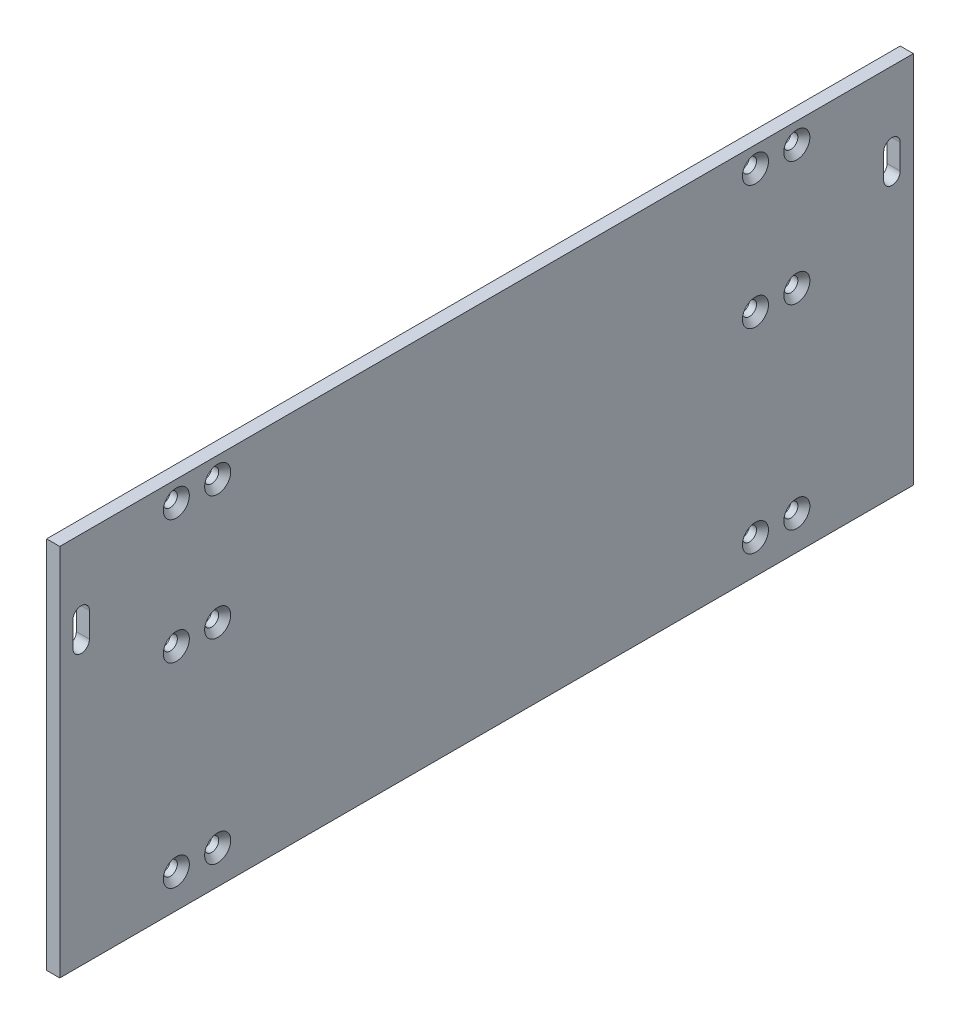
from build123d import *

# Parameters (mm, degrees)
BOSS_EXTRUDE1_DEPTH                             = 3.175
CSK_FOR_M3_FLAT_HEAD_MACHINE_SCREW1_D           = 3.4
CSK_FOR_M3_FLAT_HEAD_MACHINE_SCREW1_CSINK_D     = 6.3
CSK_FOR_M3_FLAT_HEAD_MACHINE_SCREW1_CSINK_ANGLE = 90
CUT_EXTRUDE1_DEPTH                              = 138.179749781


with BuildPart() as part:
    # Sketch1 → Boss-Extrude1 (new body)
    with BuildSketch(Plane(origin=(0, 0, 0), x_dir=(0, 0, -1), z_dir=(1, 0, 0))):
        Polygon((103.175, 0), (103.175, 3.175), (103.175, 47.175), (103.175, 50.35), (103.175, 60.35), (103.175, 90.35), (-103.175, 90.35), (-103.175, 60.35), (-103.175, 50.35), (-103.175, 47.175), (-103.175, 3.175), (-103.175, 0), align=None)
    extrude(amount=BOSS_EXTRUDE1_DEPTH)

    # CSK for M3 Flat Head Machine Screw1 (through all)
    with Locations(Plane(origin=(3.175, 0, 0), x_dir=(0, 0, -1), z_dir=(1, 0, 0))):
        with Locations((-75, 8.175), (-65, 8.175), (-75, 55.35), (-65, 55.35), (-75, 85.35), (-65, 85.35)):
            csk_for_m3_flat_head_machine_screw1 = CounterSinkHole(CSK_FOR_M3_FLAT_HEAD_MACHINE_SCREW1_D / 2, CSK_FOR_M3_FLAT_HEAD_MACHINE_SCREW1_CSINK_D / 2, counter_sink_angle=CSK_FOR_M3_FLAT_HEAD_MACHINE_SCREW1_CSINK_ANGLE)

    # Mirror1: CSK for M3 Flat Head Machine Screw1 across plane
    add(csk_for_m3_flat_head_machine_screw1.mirror(Plane.XY), mode=Mode.SUBTRACT)

    # Sketch4 → Cut-Extrude1 (cut, through all)
    with BuildSketch(Plane(origin=(3.175, 0, 0), x_dir=(0, 0, -1), z_dir=(1, 0, 0))):
        with BuildLine():
            Line((-96, 73.35), (-96, 67.35))
            ThreePointArc((-96, 67.35), (-98, 65.35), (-100, 67.35))
            Line((-100, 67.35), (-100, 73.35))
            ThreePointArc((-100, 73.35), (-98, 75.35), (-96, 73.35))
        make_face()
        with BuildLine():
            Line((96, 73.35), (96, 67.35))
            ThreePointArc((96, 67.35), (98, 65.35), (100, 67.35))
            Line((100, 67.35), (100, 73.35))
            ThreePointArc((100, 73.35), (98, 75.35), (96, 73.35))
        make_face()
    extrude(amount=-CUT_EXTRUDE1_DEPTH, mode=Mode.SUBTRACT)


solid = part.part
